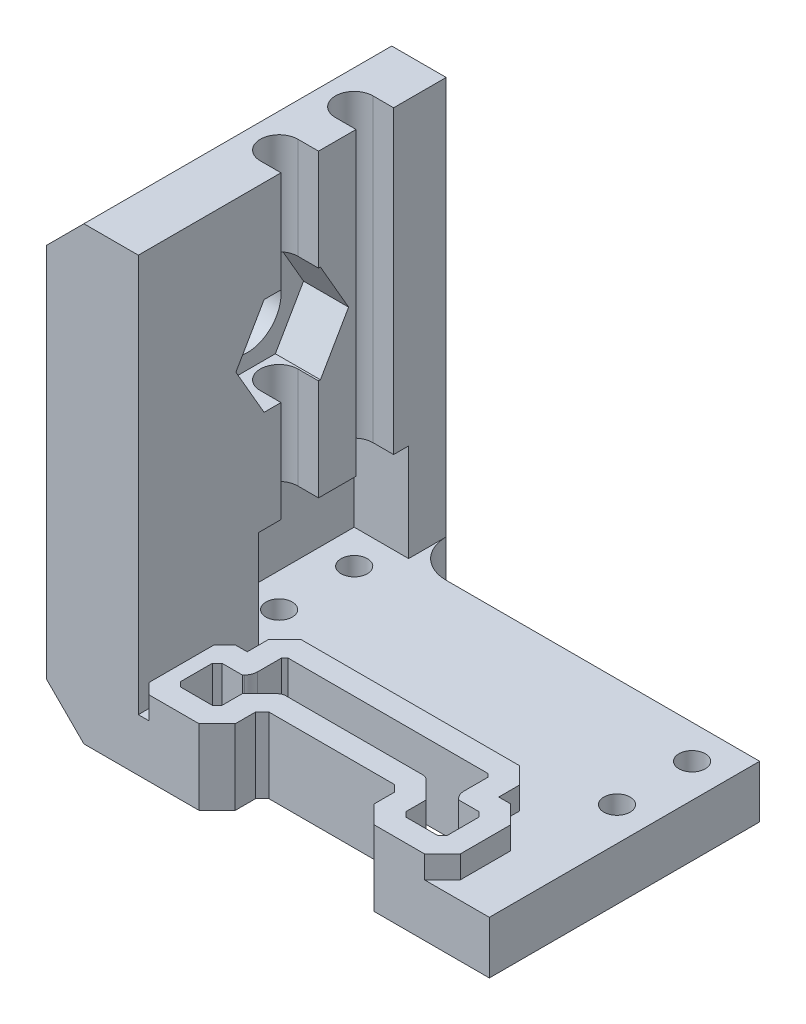
from build123d import *

# Parameters (mm, degrees)
BOSS_EXTRUDE1_DEPTH = 400
BOSS_EXTRUDE2_DEPTH = 10
SKETCH3_R           = 43.000999871
CUT_EXTRUDE1_DEPTH  = 447.360216168
BOSS_EXTRUDE3_DEPTH = 7
SKETCH5_R           = 1.75
CUT_EXTRUDE2_DEPTH  = 33
SKETCH6_W           = 36.000000185
SKETCH6_H           = 60
BOSS_EXTRUDE4_DEPTH = 5
SKETCH7_W           = 7.24997928
SKETCH7_H           = 16
BOSS_EXTRUDE5_DEPTH = 53
SKETCH8_W           = 12.24997928
SKETCH8_H           = 60
BOSS_EXTRUDE6_DEPTH = 5
FILLET1_R           = 5
SKETCH10_W          = 20.000000185
SKETCH10_H          = 40
BOSS_EXTRUDE7_DEPTH = 7.24997928
CUT_EXTRUDE3_DEPTH  = 6
CUT_EXTRUDE4_DEPTH  = 68.845857758
SKETCH12_R          = 4.5
CUT_EXTRUDE5_DEPTH  = 16
CHAMFER2_SIZE       = 5
CHAMFER3_SIZE       = 5
SKETCH13_R          = 6.5
SKETCH13_R_2        = 4.5
BOSS_EXTRUDE8_DEPTH = 2
FILLET2_R           = 1


with BuildPart() as part:
    # Sketch1 → Boss-Extrude1 (new body)
    with BuildSketch(Plane(origin=(0, 200, 0), x_dir=(1, 0, 0), z_dir=(0, 1, 0))):
        with BuildLine():
            Line((1e-09, -3.855700002), (0.25, -4.00003757))
            Line((0.25, -4.00003757), (9.078700232, -4.00003757))
            ThreePointArc((9.078700232, -4.00003757), (9.652725366, -4.114218268), (10.139360377, -4.439377387))
            Line((10.139360377, -4.439377387), (12.500020747, -6.800037757))
            Line((12.500020747, -6.800037757), (12.500020747, -9.500037757))
            Line((12.500020747, -9.500037757), (13.00002072, -10.000037755))
            Line((13.00002072, -10.000037755), (17.00002072, -10.000037755))
            Line((17.00002072, -10.000037755), (17.500020747, -9.500037752))
            Line((17.500020747, -9.500037752), (17.500020747, -5.500037752))
            Line((17.500020747, -5.500037752), (17.00002075, -5.0000377))
            Line((17.00002075, -5.0000377), (14.30002072, -5.0000377))
            Line((14.30002072, -5.0000377), (14.085807141, -4.785824121))
            ThreePointArc((14.085807141, -4.785824121), (13.652261651, -4.136977442), (13.50002072, -3.371610598))
            Line((13.50002072, -3.371610598), (13.50002072, -0.30003757))
            Line((13.50002072, -0.30003757), (13.20002072, -3.757e-05))
            Line((13.20002072, -3.757e-05), (7.50002072, -3.757e-05))
            Line((7.50002072, -3.757e-05), (7.40002072, -0.10003757))
            Line((7.40002072, -0.10003757), (-7.40002072, -0.10003757))
            Line((-7.40002072, -0.10003757), (-7.50002072, -3.757e-05))
            Line((-7.50002072, -3.757e-05), (-13.20002072, -3.757e-05))
            Line((-13.20002072, -3.757e-05), (-13.50002072, -0.30003757))
            Line((-13.50002072, -0.30003757), (-13.50002072, -3.371610628))
            ThreePointArc((-13.50002072, -3.371610628), (-13.652261651, -4.136977472), (-14.085807141, -4.785824151))
            Line((-14.085807141, -4.785824151), (-14.30002069, -5.0000377))
            Line((-14.30002069, -5.0000377), (-17.00002072, -5.0000377))
            Line((-17.00002072, -5.0000377), (-17.50002072, -5.50003767))
            Line((-17.50002072, -5.50003767), (-17.50002072, -9.50003767))
            Line((-17.50002072, -9.50003767), (-17.000020665, -10.000037755))
            Line((-17.000020665, -10.000037755), (-13.00002072, -10.000037755))
            Line((-13.00002072, -10.000037755), (-12.500020741, -9.500037764))
            Line((-12.500020741, -9.500037764), (-12.500020741, -6.800037764))
            Line((-12.500020741, -6.800037764), (-10.139360364, -4.439377387))
            ThreePointArc((-10.139360364, -4.439377387), (-9.652725352, -4.114218268), (-9.078700218, -4.00003757))
            Line((-9.078700218, -4.00003757), (-0.25, -4.00003757))
            Line((-0.25, -4.00003757), (1e-09, -3.855700002))
        make_face()
    extrude(amount=-BOSS_EXTRUDE1_DEPTH)

    # Sketch3 → Cut-Extrude1 (cut)
    with BuildSketch(Plane(origin=(0, 200, 0), x_dir=(1, 0, 0), z_dir=(0, 1, 0))):
        with Locations((0, -0.10003757)):
            Circle(SKETCH3_R)
    extrude(amount=-CUT_EXTRUDE1_DEPTH, mode=Mode.SUBTRACT)


with BuildPart() as body_2:
    # Sketch2 → Boss-Extrude2 (new body)
    with BuildSketch(Plane(origin=(0, 210, 0), x_dir=(1, 0, 0), z_dir=(0, 1, 0))):
        Polygon((-8.353826469, -7.25003757), (8.353826482, -7.25003757), (9.250020747, -8.146231835), (9.250020747, -10.846231788), (11.653826595, -13.250037755), (18.34621475, -13.250037755), (20.750020747, -10.846231878), (20.750020747, -4.153843779), (18.346214932, -1.7500377), (16.75002072, -1.7500377), (16.75002072, 1.046156508), (14.546214798, 3.24996243), (-14.546214798, 3.24996243), (-16.75002072, 1.046156508), (-16.75002072, -1.7500377), (-18.346214741, -1.7500377), (-20.75002072, -4.153843535), (-20.75002072, -10.846231691), (-18.3462148, -13.250037755), (-11.653826621, -13.250037755), (-9.250020741, -10.846231821), (-9.250020741, -8.146231842), align=None)
        with BuildLine():
            Line((13.303574111, 0.24996243), (-13.303574111, 0.24996243))
            Line((-13.303574111, 0.24996243), (-13.75002072, -0.196484179))
            Line((-13.75002072, -0.196484179), (-13.75002072, -3.371610628))
            ThreePointArc((-13.75002072, -3.371610628), (-13.883231534, -4.041306614), (-14.262583837, -4.609047456))
            Line((-14.262583837, -4.609047456), (-14.403574081, -4.7500377))
            Line((-14.403574081, -4.7500377), (-17.103574106, -4.7500377))
            Line((-17.103574106, -4.7500377), (-17.75002072, -5.396484275))
            Line((-17.75002072, -5.396484275), (-17.75002072, -9.603591056))
            Line((-17.75002072, -9.603591056), (-17.10357406, -10.250037755))
            Line((-17.10357406, -10.250037755), (-12.896467328, -10.250037755))
            Line((-12.896467328, -10.250037755), (-12.250020741, -9.603591153))
            Line((-12.250020741, -9.603591153), (-12.250020741, -6.903591155))
            Line((-12.250020741, -6.903591155), (-9.962583668, -4.616154083))
            ThreePointArc((-9.962583668, -4.616154083), (-9.557054494, -4.345188152), (-9.078700218, -4.25003757))
            Line((-9.078700218, -4.25003757), (9.078700232, -4.25003757))
            ThreePointArc((9.078700232, -4.25003757), (9.557054508, -4.345188152), (9.962583682, -4.616154083))
            Line((9.962583682, -4.616154083), (12.250020747, -6.903591148))
            Line((12.250020747, -6.903591148), (12.250020747, -9.603591144))
            Line((12.250020747, -9.603591144), (12.896467326, -10.250037755))
            Line((12.896467326, -10.250037755), (17.103574107, -10.250037755))
            Line((17.103574107, -10.250037755), (17.750020747, -9.603591147))
            Line((17.750020747, -9.603591147), (17.750020747, -5.39648437))
            Line((17.750020747, -5.39648437), (17.103574149, -4.7500377))
            Line((17.103574149, -4.7500377), (14.403574111, -4.7500377))
            Line((14.403574111, -4.7500377), (14.262583837, -4.609047426))
            ThreePointArc((14.262583837, -4.609047426), (13.883231534, -4.041306584), (13.75002072, -3.371610598))
            Line((13.75002072, -3.371610598), (13.75002072, -0.196484179))
            Line((13.75002072, -0.196484179), (13.303574111, 0.24996243))
        make_face(mode=Mode.SUBTRACT)
    extrude(amount=BOSS_EXTRUDE2_DEPTH)

    # Sketch4 → Boss-Extrude3 (add)
    with BuildSketch(Plane(origin=(0, 210, 0), x_dir=(-1, 0, 0), z_dir=(0, -1, 0))):
        Polygon((27, -13.250037755), (27, 22.74996243), (-27, 22.74996243), (-27, -13.250037755), (-18.34621475, -13.250037755), (-20.750020747, -10.846231878), (-20.750020747, -4.153843779), (-18.346214932, -1.7500377), (-16.75002072, -1.7500377), (-16.75002072, 1.046156508), (-14.546214798, 3.24996243), (14.546214798, 3.24996243), (16.75002072, 1.046156508), (16.75002072, -1.7500377), (18.346214741, -1.7500377), (20.75002072, -4.153843535), (20.75002072, -10.846231691), (18.3462148, -13.250037755), align=None)
    extrude(amount=-BOSS_EXTRUDE3_DEPTH)

    # Sketch5 → Cut-Extrude2 (cut)
    with BuildSketch(Plane(origin=(0, 210, 0), x_dir=(-1, 0, 0), z_dir=(0, -1, 0))):
        with Locations(Location((22.5, 18.24996243, 0), (0, 0, 90))):
            Circle(SKETCH5_R)
        with Locations(Location((22.5, 8.24996243, 0), (0, 0, 90))):
            Circle(SKETCH5_R)
        with Locations(Location((-22.5, 8.24996243, 0), (0, 0, 90))):
            Circle(SKETCH5_R)
        with Locations(Location((-22.5, 18.24996243, 0), (0, 0, 90))):
            Circle(SKETCH5_R)
    extrude(amount=-CUT_EXTRUDE2_DEPTH, mode=Mode.SUBTRACT)

    # Sketch6 → Boss-Extrude4 (add)
    with BuildSketch(Plane.ZY.offset(27)):
        with Locations((-4.749962337, 240)):
            Rectangle(SKETCH6_W, SKETCH6_H)
    extrude(amount=BOSS_EXTRUDE4_DEPTH)

    # Sketch7 → Boss-Extrude5 (add)
    with BuildSketch(Plane(origin=(0, 217, 0), x_dir=(1, 0, 0), z_dir=(0, 1, 0))):
        with Locations((-23.37501036, -5.250037755)):
            Rectangle(SKETCH7_W, SKETCH7_H)
    extrude(amount=BOSS_EXTRUDE5_DEPTH)

    # Sketch8 → Boss-Extrude6 (add)
    with BuildSketch(Plane(origin=(0, 0, -22.74996243), x_dir=(-1, 0, 0), z_dir=(0, 0, -1))):
        with Locations((25.87501036, 240)):
            Rectangle(SKETCH8_W, SKETCH8_H)
    extrude(amount=BOSS_EXTRUDE6_DEPTH)

    # Fillet1
    fillet1_edges = [body_2.edges().sort_by_distance(p)[0] for p in [
        (-19.75002072, 213.5, -22.74996243),
    ]]
    fillet(fillet1_edges, radius=FILLET1_R - 0.0001)  # a hair under: the kernel refuses the full size

    # Sketch10 → Boss-Extrude7 (add)
    with BuildSketch(Plane(origin=(-27, 0, 0), x_dir=(0, 0, -1), z_dir=(1, 0, 0))):
        with Locations((12.749962337, 250)):
            Rectangle(SKETCH10_W, SKETCH10_H)
    extrude(amount=BOSS_EXTRUDE7_DEPTH)

    # Sketch9 → Cut-Extrude3 (cut)
    with BuildSketch(Plane(origin=(-19.75002072, 0, 0), x_dir=(0, 0, -1), z_dir=(1, 0, 0))):
        Polygon((14.755515837, 250), (11.002739087, 256.5), (3.497185588, 256.5), (-0.255591162, 250), (3.497185588, 243.5), (11.002739087, 243.5), align=None)
    extrude(amount=-CUT_EXTRUDE3_DEPTH, mode=Mode.SUBTRACT)

    # Sketch11 → Cut-Extrude4 (cut, through all)
    with BuildSketch(Plane(origin=(0, 217, 0), x_dir=(1, 0, 0), z_dir=(0, 1, 0))):
        with BuildLine():
            Line((-22.5, 20.74996243), (-17.824832595, 20.74996243))
            Line((-17.824832595, 20.74996243), (-17.824832595, 15.74996243))
            Line((-17.824832595, 15.74996243), (-22.5, 15.74996243))
            ThreePointArc((-22.5, 15.74996243), (-25, 18.24996243), (-22.5, 20.74996243))
        make_face()
        with BuildLine():
            Line((-22.5, 10.74996243), (-17.824832595, 10.74996243))
            Line((-17.824832595, 10.74996243), (-17.824832595, 5.74996243))
            Line((-17.824832595, 5.74996243), (-22.5, 5.74996243))
            ThreePointArc((-22.5, 5.74996243), (-25, 8.24996243), (-22.5, 10.74996243))
        make_face()
    extrude(amount=CUT_EXTRUDE4_DEPTH, mode=Mode.SUBTRACT)

    # Sketch12 → Cut-Extrude5 (cut)
    with BuildSketch(Plane(origin=(-25.75002072, 0, 0), x_dir=(0, 0, -1), z_dir=(1, 0, 0))):
        with Locations((7.249962338, 250)):
            Circle(SKETCH12_R)
    extrude(amount=-CUT_EXTRUDE5_DEPTH, mode=Mode.SUBTRACT)

    # Chamfer2
    chamfer2_edges = [body_2.edges().sort_by_distance(p)[0] for p in [
        (-32, 270, -7.249962337),
    ]]
    chamfer(chamfer2_edges, length=CHAMFER2_SIZE)

    # Chamfer3
    chamfer3_edges = [body_2.edges().sort_by_distance(p)[0] for p in [
        (-32, 210, -7.249962338),
    ]]
    chamfer(chamfer3_edges, length=CHAMFER3_SIZE)

    # Sketch13 → Boss-Extrude8 (add)
    with BuildSketch(Plane.ZY.offset(32)):
        with Locations(Location((-7.249962338, 250, 0), (0, 0, 180))):
            Circle(SKETCH13_R)
        with Locations(Location((-7.249962338, 250, 0), (0, 0, 180))):
            Circle(SKETCH13_R_2, mode=Mode.SUBTRACT)
    extrude(amount=BOSS_EXTRUDE8_DEPTH)

    # Fillet2
    fillet2_edges = [body_2.edges().sort_by_distance(p)[0] for p in [
        (-32, 250, -0.749962338),
    ]]
    fillet(fillet2_edges, radius=FILLET2_R)


solid = body_2.part
